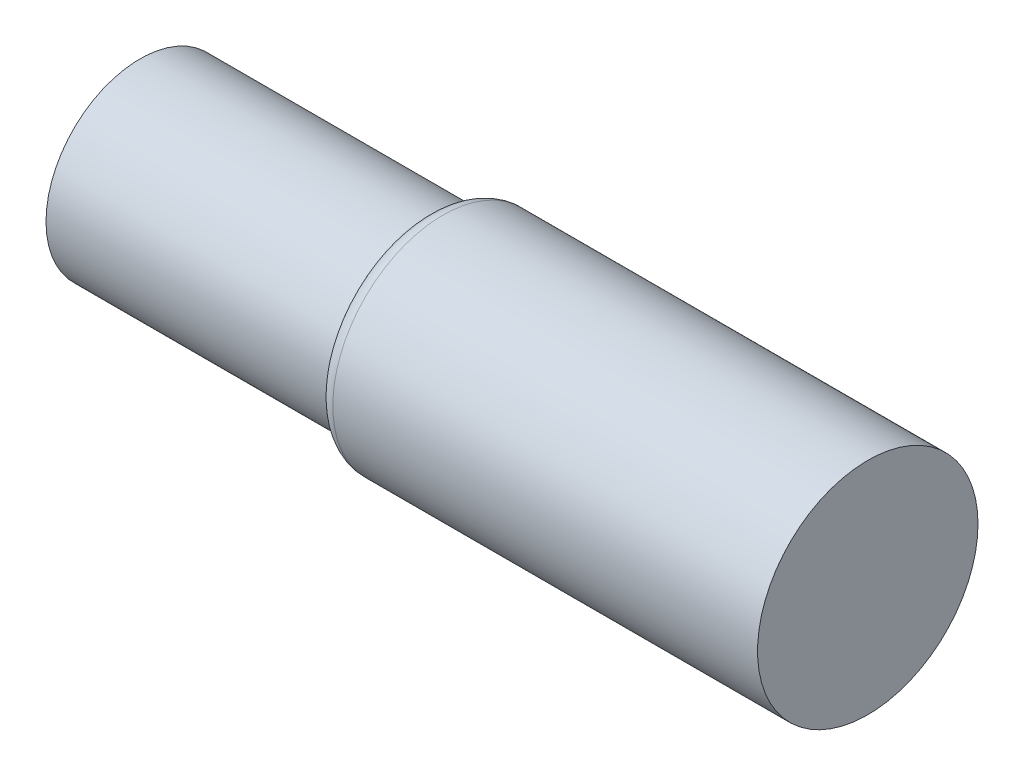
from build123d import *

# Parameters (mm, degrees)
SKETCH2_R           = 16
BOSS_EXTRUDE1_DEPTH = 48.8
SKETCH3_R           = 18.75
BOSS_EXTRUDE2_DEPTH = 75
FILLET1_R           = 2.74
SKETCH4_R           = 3
CUT_EXTRUDE1_DEPTH  = 2
SKETCH5_R           = 2
CUT_EXTRUDE2_DEPTH  = 10


with BuildPart() as part:
    # Sketch2 → Boss-Extrude1 (new body)
    with BuildSketch(Plane(origin=(0, 0, 0), x_dir=(0, 0, -1), z_dir=(1, 0, 0))):
        Circle(SKETCH2_R)
    extrude(amount=BOSS_EXTRUDE1_DEPTH)

    # Sketch3 → Boss-Extrude2 (add)
    with BuildSketch(Plane(origin=(48.8, 0, 0), x_dir=(0, 0, -1), z_dir=(1, 0, 0))):
        Circle(SKETCH3_R)
    extrude(amount=BOSS_EXTRUDE2_DEPTH)

    # Fillet1
    fillet1_edges = [part.edges().sort_by_distance(p)[0] for p in [
        (48.8, 0, 18.75),
    ]]
    fillet(fillet1_edges, radius=FILLET1_R)

    # Sketch4 → Cut-Extrude1 (cut)
    with BuildSketch(Plane.ZY):
        Circle(SKETCH4_R)
    extrude(amount=-CUT_EXTRUDE1_DEPTH, mode=Mode.SUBTRACT)

    # Sketch5 → Cut-Extrude2 (cut)
    with BuildSketch(Plane.ZY):
        with Locations((-8, 8)):
            Circle(SKETCH5_R)
        with Locations((8, 8)):
            Circle(SKETCH5_R)
        with Locations((8, -8)):
            Circle(SKETCH5_R)
        with Locations((-8, -8)):
            Circle(SKETCH5_R)
    extrude(amount=-CUT_EXTRUDE2_DEPTH, mode=Mode.SUBTRACT)


solid = part.part
